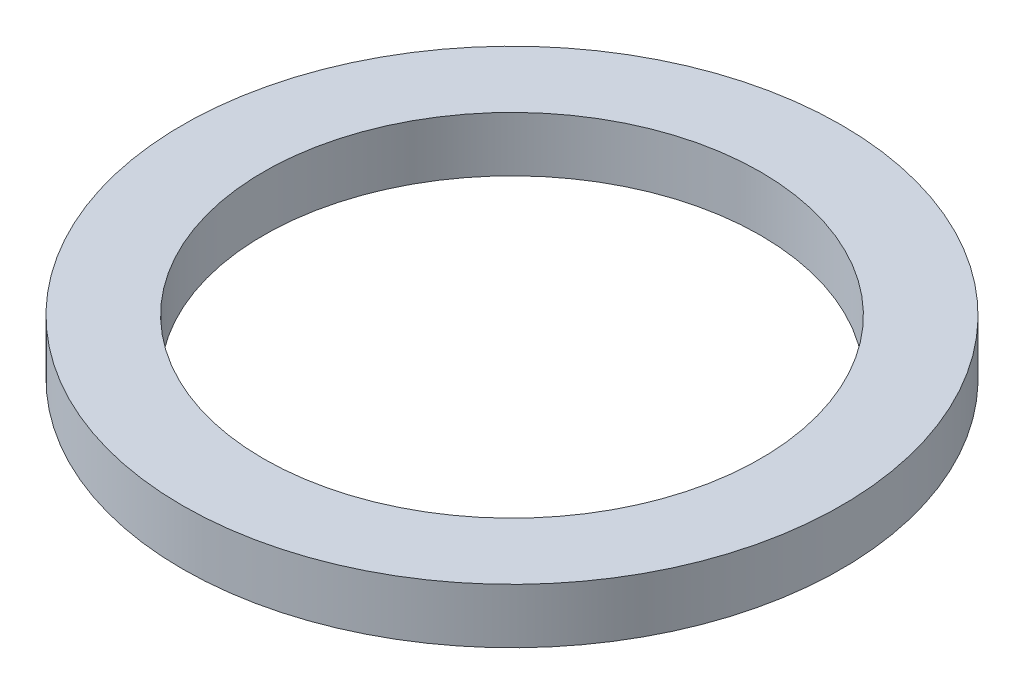
from build123d import *

# Parameters (mm, degrees)
SKETCH1_R           = 38.1
SKETCH1_R_2         = 28.7274
BOSS_EXTRUDE1_DEPTH = 6.35


with BuildPart() as part:
    # Sketch1 → Boss-Extrude1 (new body)
    with BuildSketch(Plane(origin=(0, 0, 0), x_dir=(1, 0, 0), z_dir=(0, 1, 0))):
        Circle(SKETCH1_R)
        Circle(SKETCH1_R_2, mode=Mode.SUBTRACT)
    extrude(amount=BOSS_EXTRUDE1_DEPTH)


solid = part.part
